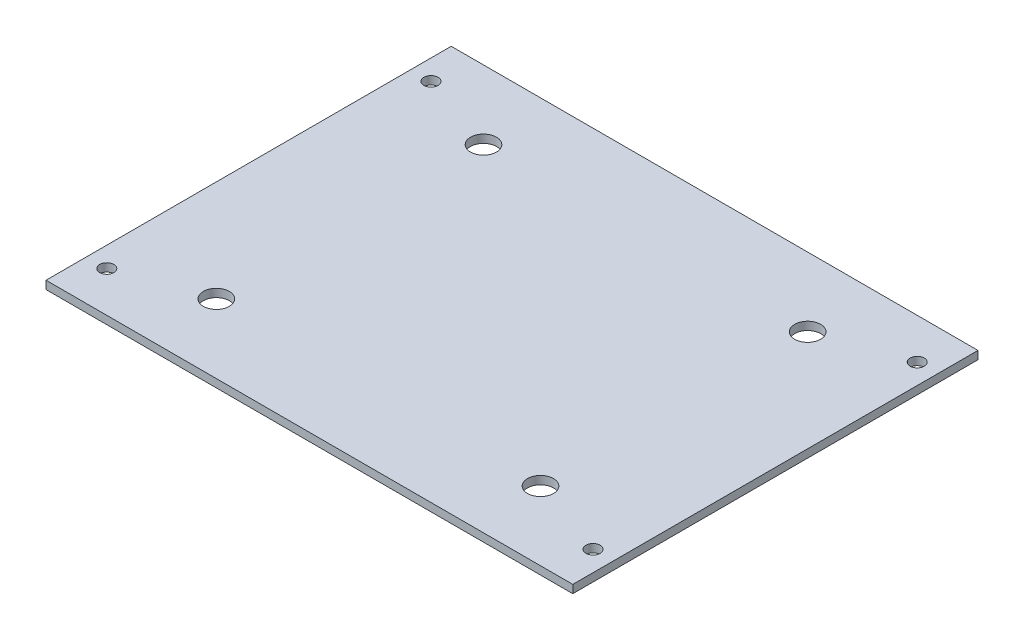
from build123d import *

# Parameters (mm, degrees)
SKETCH_1_W      = 130
SKETCH_1_H      = 100
SKETCH_1_R      = 3.2
SKETCH_1_R_2    = 1.75
EXTRUDE_1_DEPTH = 2


with BuildPart() as part:
    # Эскиз1 → Бобышка-Вытянуть1 (new body)
    with BuildSketch(Plane(origin=(0, 0, 0), x_dir=(1, 0, 0), z_dir=(0, 1, 0))):
        with Locations((65, 50)):
            Rectangle(SKETCH_1_W, SKETCH_1_H)
        with Locations((105, 17.034247801)):
            Circle(SKETCH_1_R, mode=Mode.SUBTRACT)
        with Locations((25, 17.034247801)):
            Circle(SKETCH_1_R, mode=Mode.SUBTRACT)
        with Locations((105, 82.965752199)):
            Circle(SKETCH_1_R, mode=Mode.SUBTRACT)
        with Locations((25, 82.965752199)):
            Circle(SKETCH_1_R, mode=Mode.SUBTRACT)
        with Locations((5, 90)):
            Circle(SKETCH_1_R_2, mode=Mode.SUBTRACT)
        with Locations((5, 10)):
            Circle(SKETCH_1_R_2, mode=Mode.SUBTRACT)
        with Locations((125, 10)):
            Circle(SKETCH_1_R_2, mode=Mode.SUBTRACT)
        with Locations((125, 90)):
            Circle(SKETCH_1_R_2, mode=Mode.SUBTRACT)
    extrude(amount=EXTRUDE_1_DEPTH)


solid = part.part
